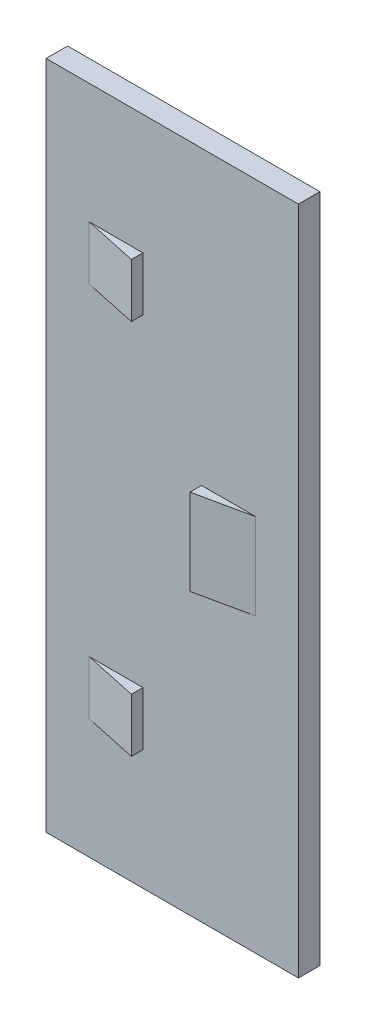
from build123d import *

# Parameters (mm, degrees)
SKETCH_1_W       = 23.45
SKETCH_1_H       = 62.3
EXTRUDE_1_DEPTH  = 2
SKETCH_2_W       = 5
SKETCH_2_H       = 5
SKETCH_2_H_2     = 8
EXTRUDE_2_DEPTH  = 1.5
CHAMFER_1_SIZE   = 1.5
CHAMFER_1_SIZE_2 = 7


with BuildPart() as part:
    # Эскиз1 → Бобышка-Вытянуть1 (new body)
    with BuildSketch(Plane.XY):
        with Locations((-11.445010077, -1532.80950355)):
            Rectangle(SKETCH_1_W, SKETCH_1_H)
    extrude(amount=EXTRUDE_1_DEPTH)

    # Эскиз2 → Бобышка-Вытянуть2 (add)
    with BuildSketch(Plane.XY.offset(2)):
        with Locations((-16.670010077, -1550.30950355)):
            Rectangle(SKETCH_2_W, SKETCH_2_H)
        with Locations((-6.220010077, -1532.80950355)):
            Rectangle(SKETCH_2_W, SKETCH_2_H_2)
        with Locations((-16.670010077, -1515.30950355)):
            Rectangle(SKETCH_2_W, SKETCH_2_H)
    extrude(amount=EXTRUDE_2_DEPTH)

    # Фаска1
    # the kernel refuses this chamfer: 7, 1.5 mm, written as the material it takes off along each edge
    with BuildSketch(Plane(origin=(-19.170010077, -1494.624450371, 3.5), x_dir=(-0.1730043027235695, 0, -0.9849210685324644), z_dir=(0, -1, 0))) as chamfer_1_piece_1_section:
        Polygon((CHAMFER_1_SIZE * 0.984921068532, CHAMFER_1_SIZE * 0.173004302724), (-CHAMFER_1_SIZE_2 * 0.173004302724, CHAMFER_1_SIZE_2 * 0.984921068532), (0, 0), align=None)
    chamfer_1_piece_1 = extrude(amount=41.370106359, mode=Mode.PRIVATE)
    chamfer_1_piece_1 = split(chamfer_1_piece_1, bisect_by=Plane(origin=(-16.689828283, -1515.30950355, 2), z_dir=(0, 0, 1)), keep=Keep.TOP, mode=Mode.PRIVATE)
    add(chamfer_1_piece_1, mode=Mode.SUBTRACT)
    with BuildSketch(Plane(origin=(-3.720010077, -1510.624450371, 3.5), x_dir=(0.17300430272357034, 0, -0.9849210685324644), z_dir=(0, -1, 0))) as chamfer_1_piece_2_section:
        Polygon((CHAMFER_1_SIZE * 0.984921068532, -CHAMFER_1_SIZE * 0.173004302724), (-CHAMFER_1_SIZE_2 * 0.173004302724, -CHAMFER_1_SIZE_2 * 0.984921068532), (0, 0), align=None)
    chamfer_1_piece_2 = extrude(amount=44.370106359, mode=Mode.PRIVATE)
    chamfer_1_piece_2 = split(chamfer_1_piece_2, bisect_by=Plane(origin=(-6.200191872, -1532.80950355, 2), z_dir=(0, 0, 1)), keep=Keep.TOP, mode=Mode.PRIVATE)
    add(chamfer_1_piece_2, mode=Mode.SUBTRACT)
    with BuildSketch(Plane(origin=(-19.170010077, -1529.624450371, 3.5), x_dir=(-0.1730043027235695, 0, -0.9849210685324644), z_dir=(0, -1, 0))) as chamfer_1_piece_3_section:
        Polygon((CHAMFER_1_SIZE * 0.984921068532, CHAMFER_1_SIZE * 0.173004302724), (-CHAMFER_1_SIZE_2 * 0.173004302724, CHAMFER_1_SIZE_2 * 0.984921068532), (0, 0), align=None)
    chamfer_1_piece_3 = extrude(amount=41.370106359, mode=Mode.PRIVATE)
    chamfer_1_piece_3 = split(chamfer_1_piece_3, bisect_by=Plane(origin=(-16.689828283, -1550.30950355, 2), z_dir=(0, 0, 1)), keep=Keep.TOP, mode=Mode.PRIVATE)
    add(chamfer_1_piece_3, mode=Mode.SUBTRACT)


solid = part.part
